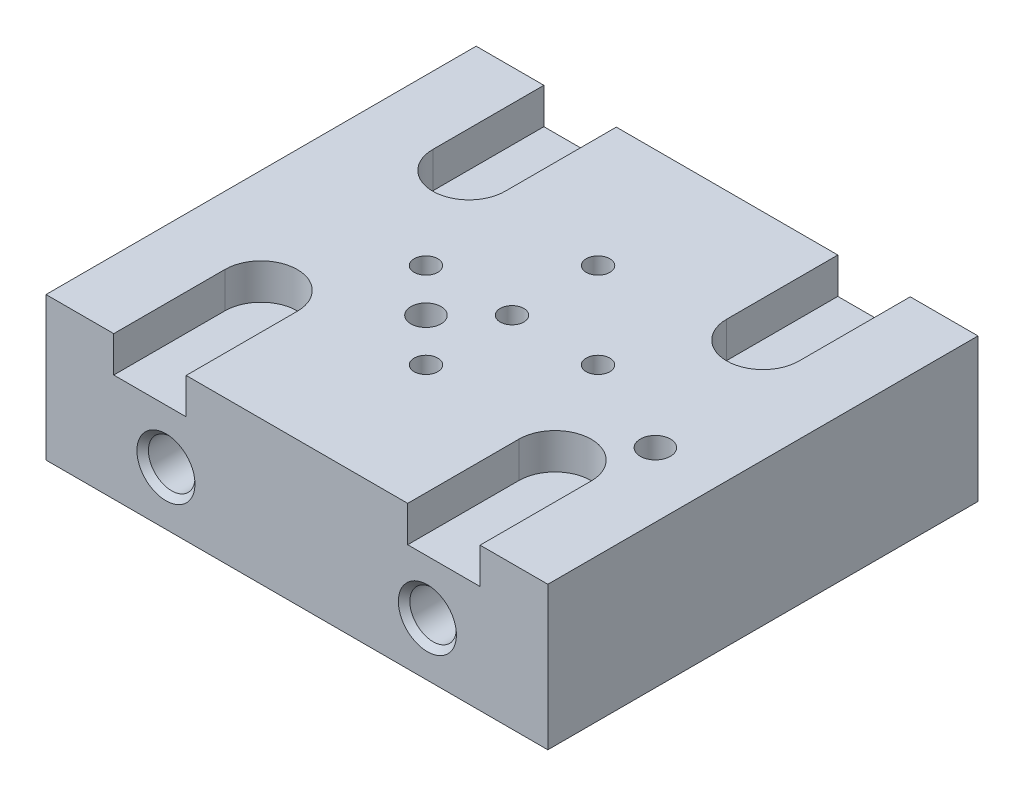
from build123d import *

# Parameters (mm, degrees)
SKETCH3_W           = 70
SKETCH3_H           = 60
BOSS_EXTRUDE3_DEPTH = 20
SKETCH4_R           = 1.65
CUT_EXTRUDE1_DEPTH  = 95.339811321
SKETCH6_R           = 2.1
CUT_EXTRUDE2_DEPTH  = 95.339811321
SKETCH9_R           = 3.25
CUT_EXTRUDE3_DEPTH  = 40.25
SKETCH11_R          = 3
CUT_EXTRUDE4_DEPTH  = 3
CUT_EXTRUDE5_DEPTH  = 5
CHAMFER1_SIZE       = 0.8


with BuildPart() as part:
    # Sketch3 → Boss-Extrude3 (new body)
    with BuildSketch(Plane(origin=(0, 0, 0), x_dir=(1, 0, 0), z_dir=(0, 1, 0))):
        with Locations((35, -30)):
            Rectangle(SKETCH3_W, SKETCH3_H)
    extrude(amount=BOSS_EXTRUDE3_DEPTH)

    # Sketch4 → Cut-Extrude1 (cut, through all)
    with BuildSketch(Plane(origin=(0, 20, 0), x_dir=(1, 0, 0), z_dir=(0, 1, 0))):
        with Locations((35, -30)):
            Circle(SKETCH4_R)
        with Locations((35, -18)):
            Circle(SKETCH4_R)
        with Locations((47, -30)):
            Circle(SKETCH4_R)
        with Locations((35, -42)):
            Circle(SKETCH4_R)
        with Locations((23, -30)):
            Circle(SKETCH4_R)
    extrude(amount=-CUT_EXTRUDE1_DEPTH, mode=Mode.SUBTRACT)

    # Sketch6 → Cut-Extrude2 (cut, through all)
    with BuildSketch(Plane.XZ):
        with Locations((29, 36)):
            Circle(SKETCH6_R)
        with Locations((61, 36)):
            Circle(SKETCH6_R)
    extrude(amount=-CUT_EXTRUDE2_DEPTH, mode=Mode.SUBTRACT)

    # Sketch9 → Cut-Extrude3 (cut)
    with BuildSketch(Plane(origin=(0, 0, 60), x_dir=(-1, 0, 0), z_dir=(0, 0, -1))):
        with Locations((-53.2, 7.5)):
            Circle(SKETCH9_R)
        with Locations((-16.732176158, 7.5)):
            Circle(SKETCH9_R)
    extrude(amount=CUT_EXTRUDE3_DEPTH, mode=Mode.SUBTRACT)

    # Sketch11 → Cut-Extrude4 (cut)
    with BuildSketch(Plane.XZ):
        with Locations((23, 30)):
            Circle(SKETCH11_R)
        with Locations((35, 42)):
            Circle(SKETCH11_R)
        with Locations((35, 30)):
            Circle(SKETCH11_R)
        with Locations((35, 18)):
            Circle(SKETCH11_R)
        with Locations((47, 30)):
            Circle(SKETCH11_R)
    extrude(amount=-CUT_EXTRUDE4_DEPTH, mode=Mode.SUBTRACT)

    # Sketch12 → Cut-Extrude5 (cut)
    with BuildSketch(Plane(origin=(0, 20, 0), x_dir=(1, 0, 0), z_dir=(0, 1, 0))):
        with BuildLine():
            Line((9.45, -60.104949747), (9.45, -44.5))
            ThreePointArc((9.45, -44.5), (14.5, -39.45), (19.55, -44.5))
            Line((19.55, -44.5), (19.55, -60.104949747))
            ThreePointArc((19.55, -60.104949747), (14.5, -65.154949747), (9.45, -60.104949747))
        make_face()
        with BuildLine():
            Line((60.55, -60.104949747), (60.55, -44.5))
            ThreePointArc((60.55, -44.5), (55.5, -39.45), (50.45, -44.5))
            Line((50.45, -44.5), (50.45, -60.104949747))
            ThreePointArc((50.45, -60.104949747), (55.5, -65.154949747), (60.55, -60.104949747))
        make_face()
        with BuildLine():
            Line((60.55, 0.104949747), (60.55, -15.5))
            ThreePointArc((60.55, -15.5), (55.5, -20.55), (50.45, -15.5))
            Line((50.45, -15.5), (50.45, 0.104949747))
            ThreePointArc((50.45, 0.104949747), (55.5, 5.154949747), (60.55, 0.104949747))
        make_face()
        with BuildLine():
            Line((9.45, 0.104949747), (9.45, -15.5))
            ThreePointArc((9.45, -15.5), (14.5, -20.55), (19.55, -15.5))
            Line((19.55, -15.5), (19.55, 0.104949747))
            ThreePointArc((19.55, 0.104949747), (14.5, 5.154949747), (9.45, 0.104949747))
        make_face()
    extrude(amount=-CUT_EXTRUDE5_DEPTH, mode=Mode.SUBTRACT)

    # Chamfer1
    chamfer1_edges = [part.edges().sort_by_distance(p)[0] for p in [
        (19.982176158, 7.5, 60),
        (56.45, 7.5, 60),
    ]]
    chamfer(chamfer1_edges, length=CHAMFER1_SIZE)


solid = part.part
